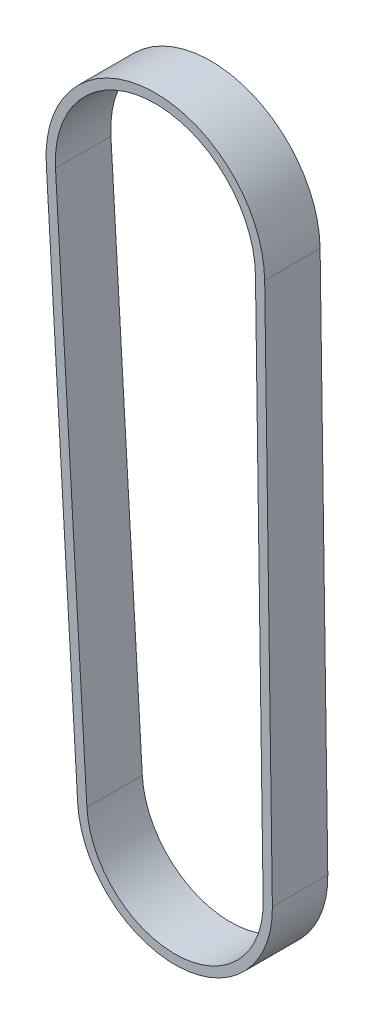
from build123d import *

# Parameters (mm, degrees)
EXTRUDE_THIN1_DEPTH = 9


with BuildPart() as part:
    # Sketch2 → Extrude-Thin1 (new body)
    with BuildSketch(Plane.XY):
        with BuildLine():
            Line((17.748190294, 0.253458642), (18.997331546, -87.216420002))
            ThreePointArc((18.997331546, -87.216420002), (3.749183154, -103.255899935), (-12.622053639, -88.364508066))
            Line((-12.622053639, -88.364508066), (-17.719835617, -1.034372129))
            ThreePointArc((-17.719835617, -1.034372129), (-0.644071441, 17.738310855), (17.748190294, 0.253458642))
        make_face()
        with BuildLine():
            Line((16.248343227, 0.232039602), (17.497484478, -87.237839042))
            ThreePointArc((17.497484478, -87.237839042), (3.694754581, -101.75688775), (-11.124602742, -88.277096337))
            Line((-11.124602742, -88.277096337), (-16.22238472, -0.9469604))
            ThreePointArc((-16.22238472, -0.9469604), (-0.589642868, 16.23929867), (16.248343227, 0.232039602))
        make_face(mode=Mode.SUBTRACT)
    extrude(amount=-EXTRUDE_THIN1_DEPTH)


solid = part.part
